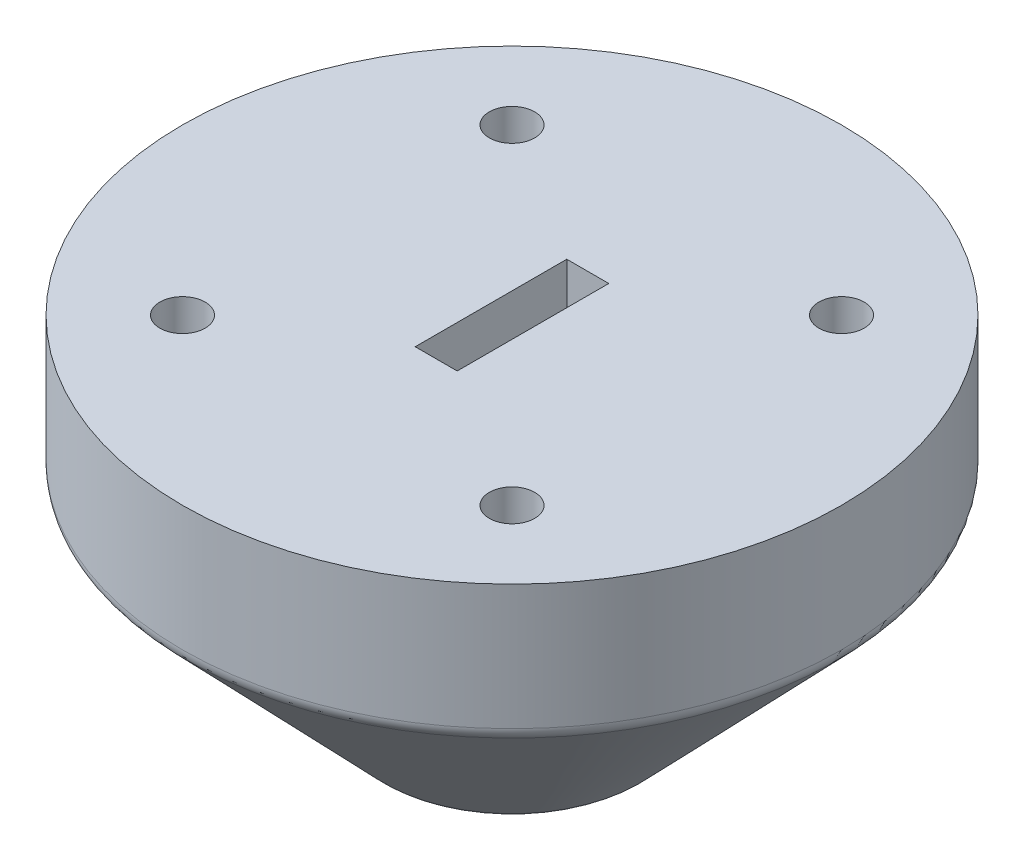
from build123d import *

# Parameters (mm, degrees)
F_5_5MM_DOWEL_HOLE7_D     = 5.5
F_5_5MM_DOWEL_HOLE7_DEPTH = 10
F_5_5MM_DOWEL_HOLE7_TIP   = 2.75
F_4_0MM_DOWEL_HOLE1_D     = 4
F_4_0MM_DOWEL_HOLE1_DEPTH = 20
F_4_0MM_DOWEL_HOLE1_TIP   = 2
CUT_EXTRUDE1_DEPTH        = 9.2
CUT_EXTRUDE1_DEPTH_BACK   = 9.2
BOSS_EXTRUDE1_DEPTH       = 10
BOSS_EXTRUDE1_DEPTH_BACK  = 10
FILLET1_R                 = 2
FILLET2_R                 = 2
FILLET6_R                 = 1
FILLET7_R                 = 1
FILLET8_R                 = 1


with BuildPart() as part:
    # Sketch1 → Revolve1 (revolve)
    with BuildSketch(Plane.XY):
        Polygon((0, 0), (40, 0), (40, -16), (15, -42), (0, -42), align=None)
    revolve(axis=Axis((0, -42, 0), (0, 1, 0)))

    # Ø5.5mm Dowel Hole7
    with Locations(Plane(origin=(0, 0, 0), x_dir=(1, 0, 0), z_dir=(0, 1, 0))):
        with Locations((20, -20), (-20, 20), (-20, -20), (20, 20)):
            Hole(F_5_5MM_DOWEL_HOLE7_D / 2, depth=F_5_5MM_DOWEL_HOLE7_DEPTH)
            with Locations((0, 0, -(F_5_5MM_DOWEL_HOLE7_DEPTH + F_5_5MM_DOWEL_HOLE7_TIP / 2))):  # 90° drill point
                Cone(0, F_5_5MM_DOWEL_HOLE7_D / 2, F_5_5MM_DOWEL_HOLE7_TIP, mode=Mode.SUBTRACT)

    # Ø4.0mm Dowel Hole1
    with Locations(Plane(origin=(0, 0, 0), x_dir=(1, 0, 0), z_dir=(0, 1, 0))):
        with Locations((-20, 20), (20, 20), (20, -20), (-20, -20)):
            Hole(F_4_0MM_DOWEL_HOLE1_D / 2, depth=F_4_0MM_DOWEL_HOLE1_DEPTH)
            with Locations((0, 0, -(F_4_0MM_DOWEL_HOLE1_DEPTH + F_4_0MM_DOWEL_HOLE1_TIP / 2))):  # 90° drill point
                Cone(0, F_4_0MM_DOWEL_HOLE1_D / 2, F_4_0MM_DOWEL_HOLE1_TIP, mode=Mode.SUBTRACT)

    # Sketch13 → Cut-Extrude1 (cut, two sides: drawn at the far end of the back side and taken through both)
    with BuildSketch(Plane.XY.offset(-CUT_EXTRUDE1_DEPTH_BACK)):
        Polygon((-2.55, 0), (2.55, 0), (2.55, -20), (1, -40), (-1, -40), (-2.55, -20), align=None)
    extrude(amount=CUT_EXTRUDE1_DEPTH + CUT_EXTRUDE1_DEPTH_BACK, mode=Mode.SUBTRACT)

    # Sketch14 → Boss-Extrude1 (add, two sides: drawn at the far end of the back side and taken through both)
    with BuildSketch(Plane(origin=(0, 0, 0), x_dir=(0, 0, -1), z_dir=(1, 0, 0)).offset(-BOSS_EXTRUDE1_DEPTH_BACK)):
        Polygon((9.2, -30), (12.2, -27), (9.2, -24), (6.2, -27), align=None)
    extrude(amount=BOSS_EXTRUDE1_DEPTH + BOSS_EXTRUDE1_DEPTH_BACK)

    # Fillet1
    fillet1_edges = [part.edges().sort_by_distance(p)[0] for p in [
        (-15, -42, 0),
    ]]
    fillet(fillet1_edges, radius=FILLET1_R)

    # Fillet2
    fillet2_edges = [part.edges().sort_by_distance(p)[0] for p in [
        (-40, -16, 0),
    ]]
    fillet(fillet2_edges, radius=FILLET2_R)

    # Fillet6
    fillet6_edges = [part.edges().sort_by_distance(p)[0] for p in [
        (1, -40, 0),
    ]]
    fillet(fillet6_edges, radius=FILLET6_R)

    # Fillet7
    fillet7_edges = [part.edges().sort_by_distance(p)[0] for p in [
        (-1, -40, 0),
    ]]
    fillet(fillet7_edges, radius=FILLET7_R)

    # Fillet8
    fillet8_edges = [part.edges().sort_by_distance(p)[0] for p in [
        (0, -27, -6.2),
    ]]
    fillet(fillet8_edges, radius=FILLET8_R)


solid = part.part
